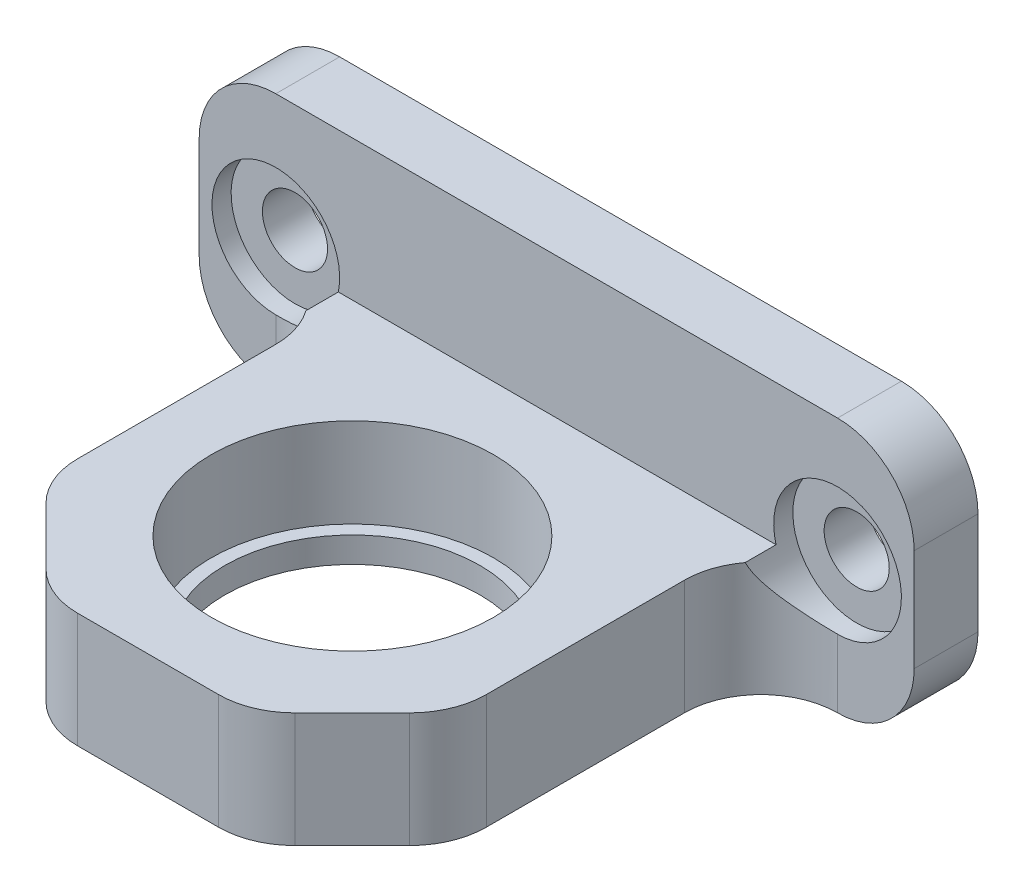
from build123d import *

# Parameters (mm, degrees)
SKETCH2_R               = 11.05
BOSS_EXTRUDE1_DEPTH     = 9
CHAMFER1_SIZE           = 8
SKETCH3_R               = 13
SKETCH3_R_2             = 10
BOSS_EXTRUDE2_DEPTH     = 2
SKETCH5_W               = 56
SKETCH5_H               = 11
BOSS_EXTRUDE3_DEPTH     = 5
SKETCH6_R               = 2.55
CUT_EXTRUDE5_DEPTH      = 47.989360498
CUT_EXTRUDE6_DEPTH      = 10
CUT_EXTRUDE6_DEPTH_BACK = 1.5
SKETCH7_R               = 5
FILLET1_R               = 6


with BuildPart() as part:
    # Sketch2 → Boss-Extrude1 (new body)
    with BuildSketch(Plane(origin=(0, 0, 0), x_dir=(1, 0, 0), z_dir=(0, 1, 0))):
        Polygon((-28, 21), (28, 21), (28, 16), (16, 16), (16, -16), (-16, -16), (-16, 16), (-28, 16), align=None)
        with Locations(Location((0, 0, 0), (0, 0, 270))):
            Circle(SKETCH2_R, mode=Mode.SUBTRACT)
    extrude(amount=BOSS_EXTRUDE1_DEPTH)

    # Chamfer1
    chamfer1_edges = [part.edges().sort_by_distance(p)[0] for p in [
        (16, 4.5, 16),
        (-16, 4.5, 16),
    ]]
    chamfer(chamfer1_edges, length=CHAMFER1_SIZE)

    # Sketch3 → Boss-Extrude2 (add)
    with BuildSketch(Plane.XZ):
        Circle(SKETCH3_R)
        with Locations(Location((0, 0, 0), (0, 0, 270))):
            Circle(SKETCH3_R_2, mode=Mode.SUBTRACT)
    extrude(amount=-BOSS_EXTRUDE2_DEPTH)

    # Sketch5 → Boss-Extrude3 (add)
    with BuildSketch(Plane.XY.offset(-16)):
        with Locations((0, 14.5)):
            Rectangle(SKETCH5_W, SKETCH5_H)
    extrude(amount=-BOSS_EXTRUDE3_DEPTH)

    # Sketch6 → Cut-Extrude5 (cut, through all)
    with BuildSketch(Plane.XY.offset(-16)):
        with Locations((-22, 10)):
            Circle(SKETCH6_R)
        with Locations((22, 10.340473159)):
            Circle(SKETCH6_R)
    extrude(amount=-CUT_EXTRUDE5_DEPTH, mode=Mode.SUBTRACT)

    # Sketch7 → Cut-Extrude6 (cut, two sides: drawn at the far end of the back side and taken through both)
    with BuildSketch(Plane.XY.offset(-16).offset(-CUT_EXTRUDE6_DEPTH_BACK)):
        with Locations(Location((22, 10.340473159, 0), (0, 0, 180))):
            Circle(SKETCH7_R)
        with Locations(Location((-22, 10, 0), (0, 0, 180))):
            Circle(SKETCH7_R)
    extrude(amount=CUT_EXTRUDE6_DEPTH + CUT_EXTRUDE6_DEPTH_BACK, mode=Mode.SUBTRACT)

    # Fillet1
    # the kernel refuses this fillet: 6 mm, written as the material it adds along each edge
    with BuildSketch(Plane(origin=(-16, 0, -16), x_dir=(-1, 0, 0), z_dir=(0, 1, 0))) as fillet1_piece_1_section:
        with BuildLine():
            CenterArc((FILLET1_R, FILLET1_R), FILLET1_R, 180, 90)
            Line((0, FILLET1_R), (0, 0))
            Line((0, 0), (FILLET1_R, 0))
        make_face()
    fillet1_piece_1 = extrude(amount=9, mode=Mode.PRIVATE)
    fillet1_piece_1 = fillet1_piece_1 - Plane(origin=(-22, 10, -14.524998949), x_dir=(-1, 0, 0), z_dir=(0, 0, 1)) * Cylinder(5, 43, mode=Mode.PRIVATE)
    add(fillet1_piece_1)
    with BuildSketch(Plane(origin=(16, 0, -16), x_dir=(0, 0, 1), z_dir=(0, 1, 0))) as fillet1_piece_2_section:
        with BuildLine():
            CenterArc((FILLET1_R, FILLET1_R), FILLET1_R, 180, 90)
            Line((0, FILLET1_R), (0, 0))
            Line((0, 0), (FILLET1_R, 0))
        make_face()
    fillet1_piece_2 = extrude(amount=9, mode=Mode.PRIVATE)
    fillet1_piece_2 = fillet1_piece_2 - Plane(origin=(22, 10.340473159, -14.541701279), x_dir=(-1, 0, 0), z_dir=(0, 0, 1)) * Cylinder(5, 42, mode=Mode.PRIVATE)
    add(fillet1_piece_2)
    # the kernel refuses this fillet: 6 mm, written as the material it takes off along each edge
    with BuildSketch(Plane(origin=(16, -6.213203436, 8), x_dir=(0, 0, -1), z_dir=(0, 1, 0))) as fillet1_2_piece_1:
        with BuildLine():
            CenterArc((FILLET1_R * 0.414213562373, FILLET1_R), FILLET1_R, 225, 45)
            Line((-FILLET1_R * 0.292893218813, FILLET1_R * 0.292893218813), (0, 0))
            Line((0, 0), (FILLET1_R * 0.414213562373, 0))
        make_face()
    extrude(amount=21.426406871, mode=Mode.SUBTRACT)
    with BuildSketch(Plane(origin=(8, -6.213203436, 16), x_dir=(-1, 0, 0), z_dir=(0, 1, 0)), Plane(origin=(-8, -6.213203436, 16), x_dir=(-0.7071067811865481, 0, -0.707106781186547), z_dir=(0, 1, 0)), Plane(origin=(-16, -6.213203436, 8), x_dir=(0, 0, -1), z_dir=(0, 1, 0))) as fillet1_2_piece_2:
        with BuildLine():
            CenterArc((FILLET1_R * 0.414213562373, -FILLET1_R), FILLET1_R, 90, 45)
            Line((-FILLET1_R * 0.292893218813, -FILLET1_R * 0.292893218813), (0, 0))
            Line((0, 0), (FILLET1_R * 0.414213562373, 0))
        make_face()
    extrude(amount=21.426406871, mode=Mode.SUBTRACT)
    with BuildSketch(Plane(origin=(28, 0, -36), x_dir=(0, 1, 0), z_dir=(0, 0, 1)), Plane(origin=(28, 20, -1), x_dir=(0, -1, 0), z_dir=(0, 0, -1)), Plane(origin=(-28, 20, -1), x_dir=(1, 0, 0), z_dir=(0, 0, -1)), Plane(origin=(-28, 0, -1), x_dir=(0, 1, 0), z_dir=(0, 0, -1))) as fillet1_2_piece_3:
        with BuildLine():
            CenterArc((FILLET1_R, FILLET1_R), FILLET1_R, 180, 90)
            Line((0, FILLET1_R), (0, 0))
            Line((0, 0), (FILLET1_R, 0))
        make_face()
    extrude(amount=35, mode=Mode.SUBTRACT)


solid = part.part
